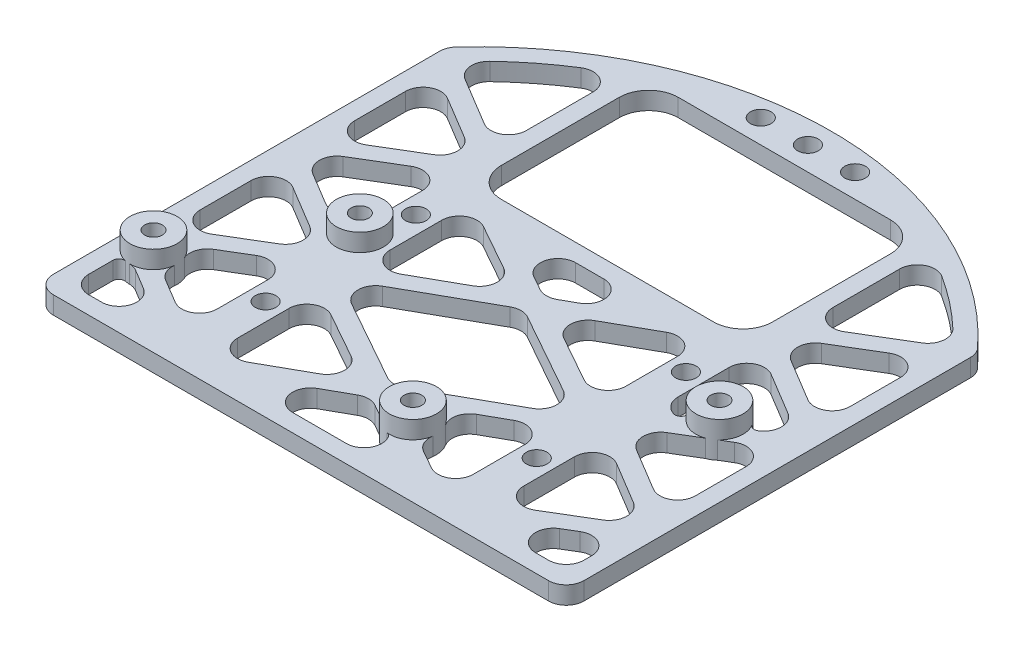
from build123d import *

# Parameters (mm, degrees)
BOSS_EXTRUDE1_DEPTH = 3
SKETCH2_W           = 46
SKETCH2_H           = 30
CUT_EXTRUDE1_DEPTH  = 76.059976019
SKETCH4_R           = 1.75
CUT_EXTRUDE3_DEPTH  = 76.059976019
SKETCH8_R           = 1.75
CUT_EXTRUDE6_DEPTH  = 76.059976019
CUT_EXTRUDE7_DEPTH  = 76.059976019
FILLET1_R           = 5
SKETCH5_R           = 4
BOSS_EXTRUDE2_DEPTH = 6
SKETCH6_R           = 1.5
CUT_EXTRUDE4_DEPTH  = 76.239617224
FILLET2_R           = 3
FILLET3_R           = 1


with BuildPart() as part:
    # Sketch1 → Boss-Extrude1 (new body)
    with BuildSketch(Plane(origin=(0, 0, 0), x_dir=(1, 0, 0), z_dir=(0, 1, 0))):
        with BuildLine():
            Line((-45, -30), (45, -30))
            Line((45, -30), (45, 39.686269666))
            ThreePointArc((45, 39.686269666), (0, 60), (-45, 39.686269666))
            Line((-45, 39.686269666), (-45, -30))
        make_face()
    extrude(amount=BOSS_EXTRUDE1_DEPTH)

    # Sketch2 → Cut-Extrude1 (cut, through all)
    with BuildSketch(Plane(origin=(0, 3, 0), x_dir=(1, 0, 0), z_dir=(0, 1, 0))):
        with Locations((0, 37)):
            Rectangle(SKETCH2_W, SKETCH2_H)
    extrude(amount=-CUT_EXTRUDE1_DEPTH, mode=Mode.SUBTRACT)

    # Sketch4 → Cut-Extrude3 (cut, through all)
    with BuildSketch(Plane(origin=(0, 3, 0), x_dir=(1, 0, 0), z_dir=(0, 1, 0))):
        with Locations(Location((23, -13, 0), (0, 0, 270))):
            Circle(SKETCH4_R)
        with Locations(Location((23, 12.299546982, 0), (0, 0, 270))):
            Circle(SKETCH4_R)
        with Locations(Location((-23, 12.5, 0), (0, 0, 270))):
            Circle(SKETCH4_R)
        with Locations(Location((-23, -13, 0), (0, 0, 270))):
            Circle(SKETCH4_R)
    extrude(amount=-CUT_EXTRUDE3_DEPTH, mode=Mode.SUBTRACT)

    # Sketch8 → Cut-Extrude6 (cut, through all)
    with BuildSketch(Plane(origin=(0, 3, 0), x_dir=(1, 0, 0), z_dir=(0, 1, 0))):
        with Locations(Location((0, 56, 0), (0, 0, 270))):
            Circle(SKETCH8_R)
        with Locations(Location((-8, 56, 0), (0, 0, 270))):
            Circle(SKETCH8_R)
        with Locations(Location((8, 56, 0), (0, 0, 270))):
            Circle(SKETCH8_R)
    extrude(amount=-CUT_EXTRUDE6_DEPTH, mode=Mode.SUBTRACT)

    # Sketch9 → Cut-Extrude7 (cut, through all)
    with BuildSketch(Plane(origin=(0, 3, 0), x_dir=(1, 0, 0), z_dir=(0, 1, 0))):
        Polygon((-42, 35.036372539), (-42, 15.820743838), (-26, 25.428558189), align=None)
        with BuildLine():
            Line((-42, 38.535697736), (-26, 28.927883386))
            Line((-26, 28.927883386), (-26, 50.724747412))
            ThreePointArc((-26, 50.724747412), (-34.541905463, 45.341556733), (-42, 38.535697736))
        make_face()
        Polygon((-42, -27), (-26, -27), (-42, -17.39218565), align=None)
        Polygon((-13.868345705, 19), (13.868345705, 19), (0, 11.219916181), align=None)
        Polygon((-20, 19), (-3.065827148, 9.5), (-20, 0), align=None)
        Polygon((20, 19), (3.065827148, 9.5), (20, 0), align=None)
        Polygon((-20, -3.439832362), (0, 7.780083819), (20, -3.439832362), (0, -14.659748543), align=None)
        Polygon((20, -25.879664724), (20, -6.879664724), (5, -15.29460186), (5, -17.464727589), align=None)
        Polygon((-20, -6.879664724), (-20, -25.879664724), (-3.065827148, -16.379664724), align=None)
        Polygon((-26, 21.929232992), (-42, 12.321418642), (-26, 2.713604291), align=None)
        Polygon((42, -27), (26, -27), (42, -17.39218565), align=None)
        Polygon((-42, 8.822093445), (-26, -0.785720906), (-42, -10.393535256), align=None)
        Polygon((-26, -4.285046102), (-42, -13.892860453), (-26, -23.500674803), align=None)
        Polygon((26, -23.500674803), (26, -4.285046102), (42, -13.892860453), align=None)
        Polygon((42, 35.036372539), (42, 15.820743838), (26, 25.428558189), align=None)
        Polygon((0, -18.099580905), (-15.865393201, -27), (15.865393201, -27), align=None)
        with BuildLine():
            Line((42, 38.535697736), (26, 28.927883386))
            Line((26, 28.927883386), (26, 50.724747412))
            ThreePointArc((26, 50.724747412), (34.541905463, 45.341556733), (42, 38.535697736))
        make_face()
        Polygon((26, 21.929232992), (42, 12.321418642), (26, 2.713604291), align=None)
        Polygon((42, 8.822093445), (26, -0.785720906), (42, -10.393535256), align=None)
    extrude(amount=-CUT_EXTRUDE7_DEPTH, mode=Mode.SUBTRACT)

    # Fillet1
    fillet1_edges = [part.edges().sort_by_distance(p)[0] for p in [
        (-23, 1.5, -22),
        (-23, 1.5, -52),
        (23, 1.5, -52),
        (23, 1.5, -22),
    ]]
    fillet(fillet1_edges, radius=FILLET1_R)

    # Sketch5 → Boss-Extrude2 (add)
    with BuildSketch(Plane(origin=(0, 0, 0), x_dir=(1, 0, 0), z_dir=(0, 1, 0))):
        with Locations(Location((-25, 5, 0), (0, 0, 104.477512186))):
            Circle(SKETCH5_R)
        with Locations(Location((-40, -15, 0), (0, 0, 60.633752996))):
            Circle(SKETCH5_R)
        with Locations(Location((7, -18, 0), (0, 0, 85.856119963))):
            Circle(SKETCH5_R)
        with Locations(Location((33, 8, 0), (0, 0, 17.562926904))):
            Circle(SKETCH5_R)
    extrude(amount=BOSS_EXTRUDE2_DEPTH)

    # Sketch6 → Cut-Extrude4 (cut, through all)
    with BuildSketch(Plane(origin=(0, 6, 0), x_dir=(1, 0, 0), z_dir=(0, 1, 0))):
        with Locations(Location((-25, 5, 0), (0, 0, 270))):
            Circle(SKETCH6_R)
        with Locations(Location((-40, -15, 0), (0, 0, 270))):
            Circle(SKETCH6_R)
        with Locations(Location((7, -18, 0), (0, 0, 270))):
            Circle(SKETCH6_R)
        with Locations(Location((33, 8, 0), (0, 0, 270))):
            Circle(SKETCH6_R)
    extrude(amount=-CUT_EXTRUDE4_DEPTH, mode=Mode.SUBTRACT)

    # Fillet2
    # the kernel refuses this fillet: 3 mm, written as the material it adds along each edge
    with BuildSketch(Plane(origin=(0, 3, -11.219916181), x_dir=(-0.8721355240948302, 0, -0.48926437394504374), z_dir=(0, -1, 0)), Plane(origin=(0, 3, 14.659748543), x_dir=(-0.8721355240948302, 0, -0.4892643739450441), z_dir=(0, -1, 0))) as fillet2_piece_1:
        with BuildLine():
            CenterArc((FILLET2_R * 0.560995809055, FILLET2_R), FILLET2_R, 211.415515058, 58.584484942)
            Line((-FILLET2_R * 0.292413873328, FILLET2_R * 0.478759255224), (0, 0))
            Line((0, 0), (FILLET2_R * 0.560995809055, 0))
        make_face()
    extrude(amount=3)
    with BuildSketch(Plane(origin=(-13.868345705, 3, -19), x_dir=(0.8721355240948303, 0, 0.4892643739450438), z_dir=(0, -1, 0))) as fillet2_piece_2:
        with BuildLine():
            CenterArc((FILLET2_R * 3.82642927585, -FILLET2_R), FILLET2_R, 90, 150.707757529)
            Line((FILLET2_R * 3.33716490191, -FILLET2_R * 1.87213552409), (0, 0))
            Line((0, 0), (FILLET2_R * 3.82642927585, 0))
        make_face()
    extrude(amount=3)
    with BuildSketch(Plane(origin=(13.868345705, 3, -19), x_dir=(-0.8721355240948307, 0, 0.48926437394504313), z_dir=(0, -1, 0)), Plane(origin=(-15.865393201, 3, 27), x_dir=(0.8721355240948305, 0, -0.4892643739450437), z_dir=(0, -1, 0))) as fillet2_piece_3:
        with BuildLine():
            CenterArc((FILLET2_R * 3.82642927585, FILLET2_R), FILLET2_R, 119.292242471, 150.707757529)
            Line((FILLET2_R * 3.33716490191, FILLET2_R * 1.87213552409), (0, 0))
            Line((0, 0), (FILLET2_R * 3.82642927585, 0))
        make_face()
    extrude(amount=3)
    with BuildSketch(Plane(origin=(-20, 3, 0), x_dir=(0, 0, -1), z_dir=(0, -1, 0)), Plane(origin=(20, 3, 6.879664724), x_dir=(0, 0, 1), z_dir=(0, -1, 0)), Plane(origin=(20, 3, 25.879664724), x_dir=(-0.8721355240948302, 0, -0.4892643739450441), z_dir=(0, -1, 0)), Plane(origin=(-20, 3, 25.879664724), x_dir=(0, 0, -1), z_dir=(0, -1, 0))) as fillet2_piece_4:
        with BuildLine():
            CenterArc((FILLET2_R * 1.70760659645, FILLET2_R), FILLET2_R, 150.707757529, 119.292242471)
            Line((FILLET2_R * 0.835471072358, FILLET2_R * 1.48926437395), (0, 0))
            Line((0, 0), (FILLET2_R * 1.70760659645, 0))
        make_face()
    extrude(amount=3)
    with BuildSketch(Plane(origin=(-20, 3, -19), x_dir=(0, 0, 1), z_dir=(0, -1, 0)), Plane(origin=(20, 3, -19), x_dir=(-0.8721355240948306, 0, 0.4892643739450432), z_dir=(0, -1, 0)), Plane(origin=(20, 3, 0), x_dir=(0, 0, -1), z_dir=(0, -1, 0)), Plane(origin=(-20, 3, 6.879664724), x_dir=(0, 0, 1), z_dir=(0, -1, 0))) as fillet2_piece_5:
        with BuildLine():
            CenterArc((FILLET2_R * 1.70760659645, -FILLET2_R), FILLET2_R, 90, 119.292242471)
            Line((FILLET2_R * 0.835471072358, -FILLET2_R * 1.48926437395), (0, 0))
            Line((0, 0), (FILLET2_R * 1.70760659645, 0))
        make_face()
    extrude(amount=3)
    with BuildSketch(Plane(origin=(-3.065827148, 3, -9.5), x_dir=(-0.8721355240948306, 0, 0.4892643739450433), z_dir=(0, -1, 0)), Plane(origin=(3.065827148, 3, -9.5), x_dir=(0.8721355240948304, 0, -0.48926437394504346), z_dir=(0, -1, 0)), Plane(origin=(20, 3, 3.439832362), x_dir=(-0.8721355240948301, 0, 0.48926437394504435), z_dir=(0, -1, 0))) as fillet2_piece_6:
        with BuildLine():
            CenterArc((FILLET2_R * 1.78254451078, FILLET2_R), FILLET2_R, 148.584484942, 121.415515058)
            Line((FILLET2_R * 0.929134828395, FILLET2_R * 1.52124074478), (0, 0))
            Line((0, 0), (FILLET2_R * 1.78254451078, 0))
        make_face()
    extrude(amount=3)
    with BuildSketch(Plane(origin=(-42, 3, 10.393535256), x_dir=(0, 0, -1), z_dir=(0, -1, 0)), Plane(origin=(-26, 3, 4.285046102), x_dir=(0, 0, 1), z_dir=(0, -1, 0)), Plane(origin=(-26, 3, 23.500674803), x_dir=(-0.8573081469264354, 0, -0.5148035947947152), z_dir=(0, -1, 0)), Plane(origin=(42, 3, 17.39218565), x_dir=(0, 0, 1), z_dir=(0, -1, 0)), Plane(origin=(42, 3, -15.820743838), x_dir=(-0.8573081469264355, 0, -0.5148035947947149), z_dir=(0, -1, 0)), Plane(origin=(26, 3, -21.929232992), x_dir=(0.8573081469264431, 0, 0.5148035947947024), z_dir=(0, -1, 0)), Plane(origin=(26, 3, 4.285046102), x_dir=(0.8573081469264363, 0, 0.5148035947947138), z_dir=(0, -1, 0)), Plane(origin=(-26, 3, -28.927883386), x_dir=(-0.8573081469264355, 0, -0.514803594794715), z_dir=(0, -1, 0)), Plane(origin=(-42, 3, -15.820743838), x_dir=(0, 0, -1), z_dir=(0, -1, 0))) as fillet2_piece_7:
        with BuildLine():
            CenterArc((FILLET2_R * 1.76693012918, FILLET2_R), FILLET2_R, 149.015672107, 120.984327893)
            Line((FILLET2_R * 0.909621982252, FILLET2_R * 1.51480359479), (0, 0))
            Line((0, 0), (FILLET2_R * 1.76693012918, 0))
        make_face()
    extrude(amount=3)
    with BuildSketch(Plane(origin=(-42, 3, -8.822093445), x_dir=(0, 0, 1), z_dir=(0, -1, 0)), Plane(origin=(26, 3, -28.927883386), x_dir=(0.8573081469264352, 0, -0.5148035947947157), z_dir=(0, -1, 0)), Plane(origin=(42, 3, -35.036372539), x_dir=(-0.8573081469264355, 0, 0.5148035947947149), z_dir=(0, -1, 0)), Plane(origin=(42, 3, -8.822093445), x_dir=(-0.8573081469264363, 0, 0.514803594794714), z_dir=(0, -1, 0)), Plane(origin=(42, 3, 10.393535256), x_dir=(0, 0, -1), z_dir=(0, -1, 0)), Plane(origin=(26, 3, 23.500674803), x_dir=(0.8573081469264356, 0, -0.5148035947947149), z_dir=(0, -1, 0)), Plane(origin=(-42, 3, -35.036372539), x_dir=(0, 0, 1), z_dir=(0, -1, 0)), Plane(origin=(-26, 3, -21.929232992), x_dir=(-0.8573081469264363, 0, 0.5148035947947139), z_dir=(0, -1, 0))) as fillet2_piece_8:
        with BuildLine():
            CenterArc((FILLET2_R * 1.76693012918, -FILLET2_R), FILLET2_R, 90, 120.984327893)
            Line((FILLET2_R * 0.909621982252, -FILLET2_R * 1.51480359479), (0, 0))
            Line((0, 0), (FILLET2_R * 1.76693012918, 0))
        make_face()
    extrude(amount=3)
    with BuildSketch(Plane(origin=(-26, 3, 0.785720906), x_dir=(-0.8573081469264362, 0, 0.5148035947947142), z_dir=(0, -1, 0)), Plane(origin=(26, 3, -25.428558189), x_dir=(0.8573081469264355, 0, -0.5148035947947154), z_dir=(0, -1, 0)), Plane(origin=(42, 3, -12.321418642), x_dir=(-0.8573081469264335, 0, 0.5148035947947183), z_dir=(0, -1, 0)), Plane(origin=(42, 3, 13.892860453), x_dir=(-0.8573081469264359, 0, 0.5148035947947146), z_dir=(0, -1, 0)), Plane(origin=(-42, 3, -12.321418642), x_dir=(0.8573081469264359, 0, -0.5148035947947146), z_dir=(0, -1, 0))) as fillet2_piece_9:
        with BuildLine():
            CenterArc((FILLET2_R * 1.66531111203, FILLET2_R), FILLET2_R, 151.968655787, 118.031344213)
            Line((FILLET2_R * 0.782620480264, FILLET2_R * 1.46995451757), (0, 0))
            Line((0, 0), (FILLET2_R * 1.66531111203, 0))
        make_face()
    extrude(amount=3)
    with BuildSketch(Plane(origin=(-20, 3, 3.439832362), x_dir=(0.8721355240948302, 0, 0.4892643739450438), z_dir=(0, -1, 0)), Plane(origin=(-3.065827148, 3, 16.379664724), x_dir=(-0.8721355240948302, 0, -0.48926437394504385), z_dir=(0, -1, 0))) as fillet2_piece_10:
        with BuildLine():
            CenterArc((FILLET2_R * 1.78254451078, -FILLET2_R), FILLET2_R, 90, 121.415515058)
            Line((FILLET2_R * 0.929134828395, -FILLET2_R * 1.52124074478), (0, 0))
            Line((0, 0), (FILLET2_R * 1.78254451078, 0))
        make_face()
    extrude(amount=3)
    with BuildSketch(Plane(origin=(0, 3, -7.780083819), x_dir=(-0.8721355240948303, 0, 0.48926437394504396), z_dir=(0, -1, 0)), Plane(origin=(0, 3, 18.099580905), x_dir=(-0.8721355240948302, 0, 0.4892643739450441), z_dir=(0, -1, 0))) as fillet2_piece_11:
        with BuildLine():
            CenterArc((FILLET2_R * 0.560995809055, -FILLET2_R), FILLET2_R, 90, 58.584484942)
            Line((-FILLET2_R * 0.292413873328, -FILLET2_R * 0.478759255224), (0, 0))
            Line((0, 0), (FILLET2_R * 0.560995809055, 0))
        make_face()
    extrude(amount=3)
    with BuildSketch(Plane(origin=(26, 3, -50.724747412), x_dir=(0.867676556849264, 0, 0.49712915091976445), z_dir=(0, -1, 0))) as fillet2_piece_12:
        with BuildLine():
            CenterArc((5.174469733, 2.996738532), FILLET2_R, 150.189752783, 122.482163992)
            Line((2.571440063, 4.488125985), (0, 0))
            ThreePointArc((0, 0), (2.657160133, -0.061967895), (5.314320267, 0))
        make_face()
    extrude(amount=3)
    with BuildSketch(Plane(origin=(42, 3, -38.535697736), x_dir=(-0.7009340915956864, 0, -0.7132260505891033), z_dir=(0, -1, 0))) as fillet2_piece_13:
        with BuildLine():
            CenterArc((3.80626467, -2.998235706), FILLET2_R, 88.034903939, 105.482762591)
            Line((0.889370989, -3.699471223), (0, 0))
            ThreePointArc((0, 0), (1.954568344, 0.033521589), (3.909136688, 0))
        make_face()
    extrude(amount=3)
    with BuildSketch(Plane(origin=(26, 3, 27), x_dir=(0.8573081469264354, 0, -0.5148035947947153), z_dir=(0, -1, 0)), Plane(origin=(-26, 3, 27), x_dir=(-1, 0, 0), z_dir=(0, -1, 0))) as fillet2_piece_14:
        with BuildLine():
            CenterArc((FILLET2_R * 3.60779949034, FILLET2_R), FILLET2_R, 120.984327893, 149.015672107)
            Line((FILLET2_R * 3.09299589555, FILLET2_R * 1.85730814693), (0, 0))
            Line((0, 0), (FILLET2_R * 3.60779949034, 0))
        make_face()
    extrude(amount=3)
    with BuildSketch(Plane(origin=(42, 3, 27), x_dir=(0, 0, -1), z_dir=(0, -1, 0)), Plane(origin=(-42, 3, 27), x_dir=(1, 0, 0), z_dir=(0, -1, 0))) as fillet2_piece_15:
        with BuildLine():
            CenterArc((FILLET2_R, -FILLET2_R), FILLET2_R, 90, 90)
            Line((0, -FILLET2_R), (0, 0))
            Line((0, 0), (FILLET2_R, 0))
        make_face()
    extrude(amount=3)
    with BuildSketch(Plane(origin=(15.865393201, 3, 27), x_dir=(-1, 0, 0), z_dir=(0, -1, 0))) as fillet2_piece_16:
        with BuildLine():
            CenterArc((11.149044576, 3), FILLET2_R, 138.182354194, 131.817645806)
            Line((8.913232514, 5.000286085), (0, 0))
            Line((0, 0), (11.149044576, 0))
        make_face()
    extrude(amount=3)
    with BuildSketch(Plane(origin=(26, 3, -2.713604291), x_dir=(0, 0, -1), z_dir=(0, -1, 0))) as fillet2_piece_17:
        with BuildLine():
            CenterArc((5.261433369, 3), FILLET2_R, 157.616979275, 112.383020725)
            Line((2.487456606, 4.142389127), (0, 0))
            Line((0, 0), (5.261433369, 0))
        make_face()
    extrude(amount=3)
    with BuildSketch(Plane(origin=(26, 3, 0.785720906), x_dir=(0.8573081469264371, 0, 0.5148035947947124), z_dir=(0, -1, 0)), Plane(origin=(-26, 3, -25.428558189), x_dir=(-0.8573081469264355, 0, -0.5148035947947154), z_dir=(0, -1, 0))) as fillet2_piece_18:
        with BuildLine():
            CenterArc((FILLET2_R * 1.66531111203, -FILLET2_R), FILLET2_R, 90, 118.031344213)
            Line((FILLET2_R * 0.782620480264, -FILLET2_R * 1.46995451757), (0, 0))
            Line((0, 0), (FILLET2_R * 1.66531111203, 0))
        make_face()
    extrude(amount=3)
    with BuildSketch(Plane(origin=(-28.968110858, 3, -4.495920422), x_dir=(-0.8573081469264363, 0, -0.5148035947947138), z_dir=(0, -1, 0))) as fillet2_piece_19:
        with BuildLine():
            CenterArc((3.837889133, 3), FILLET2_R, 184.301638766, 85.698361234)
            ThreePointArc((0.846340167, 2.774978256), (0.683618868, 1.308054895), (0, 0))
            Line((0, 0), (3.837889133, 0))
        make_face()
    extrude(amount=3)
    with BuildSketch(Plane(origin=(-26, 0, -8.872983346), x_dir=(2.547443090498425e-12, 0, -1.0), z_dir=(0, 1, 0))) as fillet2_piece_20:
        with BuildLine():
            CenterArc((1.8715793, 3), FILLET2_R, 214.849904579, 55.150095421)
            ThreePointArc((-0.59037612, 1.285714286), (-0.237892643, 0.669166134), (0, 0))
            Line((0, 0), (1.8715793, 0))
        make_face()
    extrude(amount=3)
    with BuildSketch(Plane(origin=(-38.038438258, 0, 11.513988593), x_dir=(0.6641169725065638, 0, 0.7476286824545432), z_dir=(0, 1, 0))) as fillet2_piece_21:
        with BuildLine():
            CenterArc((3.584723091, 2.836229372), FILLET2_R, 169.369710348, 81.611154202)
            Line((0.636209196, 3.389642245), (0, 0))
            ThreePointArc((0, 0), (1.30353567, 0.218360837), (2.607071339, 0))
        make_face()
    extrude(amount=3)
    with BuildSketch(Plane(origin=(-39.398287533, 3, 18.954483798), x_dir=(0.8573081469264369, 0, 0.514803594794713), z_dir=(0, -1, 0))) as fillet2_piece_22:
        with BuildLine():
            CenterArc((0.916528158, 3), FILLET2_R, 240.300443323, 29.699556677)
            ThreePointArc((-0.569827685, 0.394093956), (-0.276365278, 0.209407505), (0, 0))
            Line((0, 0), (0.916528158, 0))
        make_face()
    extrude(amount=3)
    with BuildSketch(Plane(origin=(-36.612875651, 3, 17.127766117), x_dir=(0.32944967336875186, 0, -0.944173137044908), z_dir=(0, -1, 0))) as fillet2_piece_23:
        with BuildLine():
            CenterArc((2.456004647, 2.924267755), FILLET2_R, 191.748951575, 65.349694513)
            Line((-0.481142949, 2.313396247), (0, 0))
            ThreePointArc((0, 0), (0.893092599, 0.100976326), (1.786185198, 0))
        make_face()
    extrude(amount=3)
    with BuildSketch(Plane(origin=(3.611541217, 3, 20.125640393), x_dir=(-0.8721355240948324, 0, -0.48926437394504013), z_dir=(0, -1, 0))) as fillet2_piece_24:
        with BuildLine():
            CenterArc((0.653419354, -3), FILLET2_R, 90, 21.527326174)
            ThreePointArc((-0.447415438, -0.209272002), (-0.220474399, -0.111548713), (0, 0))
            Line((0, 0), (0.653419354, 0))
        make_face()
    extrude(amount=3)
    with BuildSketch(Plane(origin=(10.209523917, 3, 20.387248673), x_dir=(0.3835847553532739, 0, -0.9235056770050571), z_dir=(0, -1, 0))) as fillet2_piece_25:
        with BuildLine():
            CenterArc((2.677161453, 2.909794317), FILLET2_R, 186.736334262, 69.177648382)
            Line((-0.302127936, 2.557892711), (0, 0))
            ThreePointArc((0, 0), (0.973513256, 0.120274244), (1.947026511, 0))
        make_face()
    extrude(amount=3)
    with BuildSketch(Plane(origin=(7.289045258, 0, 14.010457064), x_dir=(0.8567896507951098, 0, 0.515666068585469), z_dir=(0, 1, 0))) as fillet2_piece_26:
        with BuildLine():
            CenterArc((4.976457574, 2.675437448), FILLET2_R, 150.334228806, 92.767664896)
            Line((2.369675526, 4.160256413), (0, 0))
            ThreePointArc((0, 0), (1.809620936, 0.432750069), (3.619241872, 0))
        make_face()
    extrude(amount=3)
    with BuildSketch(Plane(origin=(-42, 3, -38.535697736), x_dir=(0.8573081469264355, 0, 0.5148035947947152), z_dir=(0, -1, 0))) as fillet2_piece_27:
        with BuildLine():
            CenterArc((3.804874254, -3), FILLET2_R, 90, 105.482762591)
            ThreePointArc((0.913741829, -3.800845369), (0.424277945, -1.908258194), (0, 0))
            Line((0, 0), (3.804874254, 0))
        make_face()
    extrude(amount=3)
    with BuildSketch(Plane(origin=(-26, 3, -50.724747412), x_dir=(-0.8676765568492624, 0, 0.4971291509197673), z_dir=(0, -1, 0))) as fillet2_piece_28:
        with BuildLine():
            CenterArc((5.174469733, -2.996738532), FILLET2_R, 87.328083225, 122.482163992)
            Line((2.571440063, -4.488125985), (0, 0))
            ThreePointArc((0, 0), (2.657160133, 0.061967895), (5.314320267, 0))
        make_face()
    extrude(amount=3)
    # the kernel refuses this fillet: 3 mm, written as the material it takes off along each edge
    with BuildSketch(Plane(origin=(-45, -2.951154732, -39.686269666), x_dir=(0.6687837100994087, 0, -0.7434570257289052), z_dir=(0, 1, 0))) as fillet2_2_piece_1:
        with BuildLine():
            CenterArc((1.150950345, -2.999854841), FILLET2_R, 89.436361873, 42.536898363)
            Line((-0.855400785, -0.769483764), (0, 0))
            ThreePointArc((0, 0), (0.590230946, 0.002903175), (1.180461893, 0))
        make_face()
    extrude(amount=8.902309463, mode=Mode.SUBTRACT)
    with BuildSketch(Plane(origin=(45, -2.951154732, -39.686269666), x_dir=(-0.6687837100993999, 0, -0.7434570257289133), z_dir=(0, 1, 0))) as fillet2_2_piece_2:
        with BuildLine():
            CenterArc((1.150950345, 2.999854841), FILLET2_R, 228.026739764, 42.536898363)
            Line((-0.855400785, 0.769483764), (0, 0))
            ThreePointArc((0, 0), (0.590230946, -0.002903175), (1.180461893, 0))
        make_face()
    extrude(amount=8.902309463, mode=Mode.SUBTRACT)
    with BuildSketch(Plane(origin=(45, -7.5, 30), x_dir=(0, 0, -1), z_dir=(0, 1, 0)), Plane(origin=(-45, -7.5, 30), x_dir=(1, 0, 0), z_dir=(0, 1, 0))) as fillet2_2_piece_3:
        with BuildLine():
            CenterArc((FILLET2_R, FILLET2_R), FILLET2_R, 180, 90)
            Line((0, FILLET2_R), (0, 0))
            Line((0, 0), (FILLET2_R, 0))
        make_face()
    extrude(amount=18, mode=Mode.SUBTRACT)

    # Fillet3
    # the kernel refuses this fillet: 1 mm, written as the material it adds along each edge
    with BuildSketch(Plane(origin=(36.813544464, 0, -9.207012271), x_dir=(-0.4176759762879644, 0, -0.9085960482149896), z_dir=(0, 1, 0))) as fillet3_piece_1:
        with BuildLine():
            CenterArc((1.116313487, -0.992277865), FILLET3_R, 97.125021965, 90.745907422)
            Line((0.125734415, -1.12921983), (0.026676507, -1.142914027))
            ThreePointArc((0.026676507, -1.142914027), (0.016171177, -1.058375566), (-0.099396789, -0.010967149))
            Line((-0.099396789, -0.010967149), (0.012403483, 0.099227786))
            ThreePointArc((0.012403483, 0.099227786), (0.496139327, 0.069111458), (0.979875172, 0.099227786))
            Line((0.979875172, 0.099227786), (0.992278655, 0))
        make_face()
    extrude(amount=3)
    with BuildSketch(Plane(origin=(30.142389127, 3, -5.201060898), x_dir=(-0.5526302617015463, 0, -0.8334265377654352), z_dir=(0, -1, 0))) as fillet3_piece_2:
        with BuildLine():
            CenterArc((1.695392732, -0.982096796), FILLET3_R, 100.858081172, 130.539252892)
            ThreePointArc((1.071476773, -1.763588239), (0.379330936, -0.976820241), (0, 0))
            ThreePointArc((0, 0), (0.753507881, -0.071612815), (1.507015762, 0))
        make_face()
    extrude(amount=3)
    with BuildSketch(Plane(origin=(-42, 3, 18.464101615), x_dir=(0.9350208921259093, 0, 0.3545926272330953), z_dir=(0, -1, 0))) as fillet3_piece_3:
        with BuildLine():
            CenterArc((1.443818006, 0.987048159), FILLET3_R, 159.231520484, 101.536959033)
            Line((0.508797114, 1.341640786), (0, 0))
            ThreePointArc((0, 0), (0.641696892, 0.051807363), (1.283393783, 0))
        make_face()
    extrude(amount=3)
    with BuildSketch(Plane(origin=(6.952160687, 3, 21.999713915), x_dir=(-0.9980038990839226, 0, -0.06315233497890253), z_dir=(0, -1, 0))) as fillet3_piece_4:
        with BuildLine():
            CenterArc((0.460906767, -0.998687812), FILLET3_R, 92.935507704, 52.356017261)
            ThreePointArc((-0.361153059, -0.429286685), (-0.190633094, -0.206182891), (0, 0))
            ThreePointArc((0, 0), (0.204847452, -0.005248754), (0.409694904, 0))
        make_face()
    extrude(amount=3)


solid = part.part
